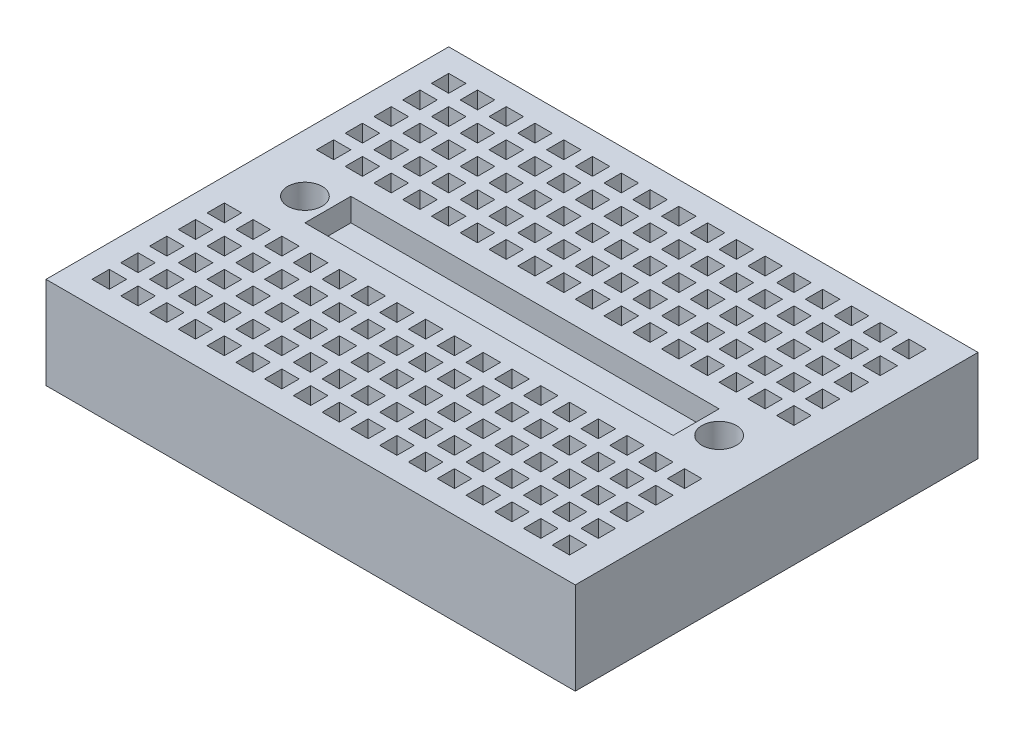
from build123d import *

# Parameters (mm, degrees)
SKETCH1_W           = 46
SKETCH1_H           = 35
SKETCH1_R           = 1.5
BOSS_EXTRUDE1_DEPTH = 8
SKETCH3_W           = 1.5
SKETCH3_H           = 1.5
CUT_EXTRUDE2_DEPTH  = 7
SKETCH2_W           = 32
SKETCH2_H           = 4
CUT_EXTRUDE1_DEPTH  = 2


with BuildPart() as part:
    # Sketch1 → Boss-Extrude1 (new body)
    with BuildSketch(Plane(origin=(0, 0, 0), x_dir=(1, 0, 0), z_dir=(0, 1, 0))):
        Rectangle(SKETCH1_W, SKETCH1_H)
        with Locations((18, 0)):
            Circle(SKETCH1_R, mode=Mode.SUBTRACT)
        with Locations((-18, 0)):
            Circle(SKETCH1_R, mode=Mode.SUBTRACT)
    extrude(amount=BOSS_EXTRUDE1_DEPTH)

    # Sketch3 → Cut-Extrude2 (cut)
    with BuildSketch(Plane(origin=(0, 8, 0), x_dir=(1, 0, 0), z_dir=(0, 1, 0))):
        with Locations((-20.25, 14.75)):
            Rectangle(SKETCH3_W, SKETCH3_H)
        with Locations((-17.75, 14.75)):
            Rectangle(SKETCH3_W, SKETCH3_H)
        with Locations((-15.25, 14.75)):
            Rectangle(SKETCH3_W, SKETCH3_H)
        with Locations((-12.75, 14.75)):
            Rectangle(SKETCH3_W, SKETCH3_H)
        with Locations((-10.25, 14.75)):
            Rectangle(SKETCH3_W, SKETCH3_H)
        with Locations((-7.75, 14.75)):
            Rectangle(SKETCH3_W, SKETCH3_H)
        with Locations((-5.25, 14.75)):
            Rectangle(SKETCH3_W, SKETCH3_H)
        with Locations((-2.75, 14.75)):
            Rectangle(SKETCH3_W, SKETCH3_H)
        with Locations((-0.25, 14.75)):
            Rectangle(SKETCH3_W, SKETCH3_H)
        with Locations((2.25, 14.75)):
            Rectangle(SKETCH3_W, SKETCH3_H)
        with Locations((4.75, 14.75)):
            Rectangle(SKETCH3_W, SKETCH3_H)
        with Locations((7.25, 14.75)):
            Rectangle(SKETCH3_W, SKETCH3_H)
        with Locations((9.75, 14.75)):
            Rectangle(SKETCH3_W, SKETCH3_H)
        with Locations((12.25, 14.75)):
            Rectangle(SKETCH3_W, SKETCH3_H)
        with Locations((14.75, 14.75)):
            Rectangle(SKETCH3_W, SKETCH3_H)
        with Locations((17.25, 14.75)):
            Rectangle(SKETCH3_W, SKETCH3_H)
        with Locations((19.75, 14.75)):
            Rectangle(SKETCH3_W, SKETCH3_H)
        with Locations((-17.75, 12.25)):
            Rectangle(SKETCH3_W, SKETCH3_H)
        with Locations((-15.25, 12.25)):
            Rectangle(SKETCH3_W, SKETCH3_H)
        with Locations((-12.75, 12.25)):
            Rectangle(SKETCH3_W, SKETCH3_H)
        with Locations((-10.25, 12.25)):
            Rectangle(SKETCH3_W, SKETCH3_H)
        with Locations((-7.75, 12.25)):
            Rectangle(SKETCH3_W, SKETCH3_H)
        with Locations((-5.25, 12.25)):
            Rectangle(SKETCH3_W, SKETCH3_H)
        with Locations((-2.75, 12.25)):
            Rectangle(SKETCH3_W, SKETCH3_H)
        with Locations((-0.25, 12.25)):
            Rectangle(SKETCH3_W, SKETCH3_H)
        with Locations((2.25, 12.25)):
            Rectangle(SKETCH3_W, SKETCH3_H)
        with Locations((4.75, 12.25)):
            Rectangle(SKETCH3_W, SKETCH3_H)
        with Locations((7.25, 12.25)):
            Rectangle(SKETCH3_W, SKETCH3_H)
        with Locations((9.75, 12.25)):
            Rectangle(SKETCH3_W, SKETCH3_H)
        with Locations((12.25, 12.25)):
            Rectangle(SKETCH3_W, SKETCH3_H)
        with Locations((14.75, 12.25)):
            Rectangle(SKETCH3_W, SKETCH3_H)
        with Locations((17.25, 12.25)):
            Rectangle(SKETCH3_W, SKETCH3_H)
        with Locations((19.75, 12.25)):
            Rectangle(SKETCH3_W, SKETCH3_H)
        with Locations((-17.75, 9.75)):
            Rectangle(SKETCH3_W, SKETCH3_H)
        with Locations((-15.25, 9.75)):
            Rectangle(SKETCH3_W, SKETCH3_H)
        with Locations((-12.75, 9.75)):
            Rectangle(SKETCH3_W, SKETCH3_H)
        with Locations((-10.25, 9.75)):
            Rectangle(SKETCH3_W, SKETCH3_H)
        with Locations((-7.75, 9.75)):
            Rectangle(SKETCH3_W, SKETCH3_H)
        with Locations((-5.25, 9.75)):
            Rectangle(SKETCH3_W, SKETCH3_H)
        with Locations((-2.75, 9.75)):
            Rectangle(SKETCH3_W, SKETCH3_H)
        with Locations((-0.25, 9.75)):
            Rectangle(SKETCH3_W, SKETCH3_H)
        with Locations((2.25, 9.75)):
            Rectangle(SKETCH3_W, SKETCH3_H)
        with Locations((4.75, 9.75)):
            Rectangle(SKETCH3_W, SKETCH3_H)
        with Locations((7.25, 9.75)):
            Rectangle(SKETCH3_W, SKETCH3_H)
        with Locations((9.75, 9.75)):
            Rectangle(SKETCH3_W, SKETCH3_H)
        with Locations((12.25, 9.75)):
            Rectangle(SKETCH3_W, SKETCH3_H)
        with Locations((14.75, 9.75)):
            Rectangle(SKETCH3_W, SKETCH3_H)
        with Locations((17.25, 9.75)):
            Rectangle(SKETCH3_W, SKETCH3_H)
        with Locations((19.75, 9.75)):
            Rectangle(SKETCH3_W, SKETCH3_H)
        with Locations((-17.75, 7.25)):
            Rectangle(SKETCH3_W, SKETCH3_H)
        with Locations((-15.25, 7.25)):
            Rectangle(SKETCH3_W, SKETCH3_H)
        with Locations((-12.75, 7.25)):
            Rectangle(SKETCH3_W, SKETCH3_H)
        with Locations((-10.25, 7.25)):
            Rectangle(SKETCH3_W, SKETCH3_H)
        with Locations((-7.75, 7.25)):
            Rectangle(SKETCH3_W, SKETCH3_H)
        with Locations((-5.25, 7.25)):
            Rectangle(SKETCH3_W, SKETCH3_H)
        with Locations((-2.75, 7.25)):
            Rectangle(SKETCH3_W, SKETCH3_H)
        with Locations((-0.25, 7.25)):
            Rectangle(SKETCH3_W, SKETCH3_H)
        with Locations((2.25, 7.25)):
            Rectangle(SKETCH3_W, SKETCH3_H)
        with Locations((4.75, 7.25)):
            Rectangle(SKETCH3_W, SKETCH3_H)
        with Locations((7.25, 7.25)):
            Rectangle(SKETCH3_W, SKETCH3_H)
        with Locations((9.75, 7.25)):
            Rectangle(SKETCH3_W, SKETCH3_H)
        with Locations((12.25, 7.25)):
            Rectangle(SKETCH3_W, SKETCH3_H)
        with Locations((14.75, 7.25)):
            Rectangle(SKETCH3_W, SKETCH3_H)
        with Locations((17.25, 7.25)):
            Rectangle(SKETCH3_W, SKETCH3_H)
        with Locations((19.75, 7.25)):
            Rectangle(SKETCH3_W, SKETCH3_H)
        with Locations((-17.75, 4.75)):
            Rectangle(SKETCH3_W, SKETCH3_H)
        with Locations((-15.25, 4.75)):
            Rectangle(SKETCH3_W, SKETCH3_H)
        with Locations((-12.75, 4.75)):
            Rectangle(SKETCH3_W, SKETCH3_H)
        with Locations((-10.25, 4.75)):
            Rectangle(SKETCH3_W, SKETCH3_H)
        with Locations((-7.75, 4.75)):
            Rectangle(SKETCH3_W, SKETCH3_H)
        with Locations((-5.25, 4.75)):
            Rectangle(SKETCH3_W, SKETCH3_H)
        with Locations((-2.75, 4.75)):
            Rectangle(SKETCH3_W, SKETCH3_H)
        with Locations((-0.25, 4.75)):
            Rectangle(SKETCH3_W, SKETCH3_H)
        with Locations((2.25, 4.75)):
            Rectangle(SKETCH3_W, SKETCH3_H)
        with Locations((4.75, 4.75)):
            Rectangle(SKETCH3_W, SKETCH3_H)
        with Locations((7.25, 4.75)):
            Rectangle(SKETCH3_W, SKETCH3_H)
        with Locations((9.75, 4.75)):
            Rectangle(SKETCH3_W, SKETCH3_H)
        with Locations((12.25, 4.75)):
            Rectangle(SKETCH3_W, SKETCH3_H)
        with Locations((14.75, 4.75)):
            Rectangle(SKETCH3_W, SKETCH3_H)
        with Locations((17.25, 4.75)):
            Rectangle(SKETCH3_W, SKETCH3_H)
        with Locations((19.75, 4.75)):
            Rectangle(SKETCH3_W, SKETCH3_H)
        with Locations((-20.25, 12.25)):
            Rectangle(SKETCH3_W, SKETCH3_H)
        with Locations((-20.25, 9.75)):
            Rectangle(SKETCH3_W, SKETCH3_H)
        with Locations((-20.25, 7.25)):
            Rectangle(SKETCH3_W, SKETCH3_H)
        with Locations((-20.25, 4.75)):
            Rectangle(SKETCH3_W, SKETCH3_H)
        with Locations((-20.25, -4.75)):
            Rectangle(SKETCH3_W, SKETCH3_H)
        with Locations((-20.25, -7.25)):
            Rectangle(SKETCH3_W, SKETCH3_H)
        with Locations((-20.25, -9.75)):
            Rectangle(SKETCH3_W, SKETCH3_H)
        with Locations((-20.25, -12.25)):
            Rectangle(SKETCH3_W, SKETCH3_H)
        with Locations((19.75, -4.75)):
            Rectangle(SKETCH3_W, SKETCH3_H)
        with Locations((17.25, -4.75)):
            Rectangle(SKETCH3_W, SKETCH3_H)
        with Locations((14.75, -4.75)):
            Rectangle(SKETCH3_W, SKETCH3_H)
        with Locations((12.25, -4.75)):
            Rectangle(SKETCH3_W, SKETCH3_H)
        with Locations((9.75, -4.75)):
            Rectangle(SKETCH3_W, SKETCH3_H)
        with Locations((7.25, -4.75)):
            Rectangle(SKETCH3_W, SKETCH3_H)
        with Locations((4.75, -4.75)):
            Rectangle(SKETCH3_W, SKETCH3_H)
        with Locations((2.25, -4.75)):
            Rectangle(SKETCH3_W, SKETCH3_H)
        with Locations((-0.25, -4.75)):
            Rectangle(SKETCH3_W, SKETCH3_H)
        with Locations((-2.75, -4.75)):
            Rectangle(SKETCH3_W, SKETCH3_H)
        with Locations((-5.25, -4.75)):
            Rectangle(SKETCH3_W, SKETCH3_H)
        with Locations((-7.75, -4.75)):
            Rectangle(SKETCH3_W, SKETCH3_H)
        with Locations((-10.25, -4.75)):
            Rectangle(SKETCH3_W, SKETCH3_H)
        with Locations((-12.75, -4.75)):
            Rectangle(SKETCH3_W, SKETCH3_H)
        with Locations((-15.25, -4.75)):
            Rectangle(SKETCH3_W, SKETCH3_H)
        with Locations((-17.75, -4.75)):
            Rectangle(SKETCH3_W, SKETCH3_H)
        with Locations((19.75, -7.25)):
            Rectangle(SKETCH3_W, SKETCH3_H)
        with Locations((17.25, -7.25)):
            Rectangle(SKETCH3_W, SKETCH3_H)
        with Locations((14.75, -7.25)):
            Rectangle(SKETCH3_W, SKETCH3_H)
        with Locations((12.25, -7.25)):
            Rectangle(SKETCH3_W, SKETCH3_H)
        with Locations((9.75, -7.25)):
            Rectangle(SKETCH3_W, SKETCH3_H)
        with Locations((7.25, -7.25)):
            Rectangle(SKETCH3_W, SKETCH3_H)
        with Locations((4.75, -7.25)):
            Rectangle(SKETCH3_W, SKETCH3_H)
        with Locations((2.25, -7.25)):
            Rectangle(SKETCH3_W, SKETCH3_H)
        with Locations((-0.25, -7.25)):
            Rectangle(SKETCH3_W, SKETCH3_H)
        with Locations((-2.75, -7.25)):
            Rectangle(SKETCH3_W, SKETCH3_H)
        with Locations((-5.25, -7.25)):
            Rectangle(SKETCH3_W, SKETCH3_H)
        with Locations((-7.75, -7.25)):
            Rectangle(SKETCH3_W, SKETCH3_H)
        with Locations((-10.25, -7.25)):
            Rectangle(SKETCH3_W, SKETCH3_H)
        with Locations((-12.75, -7.25)):
            Rectangle(SKETCH3_W, SKETCH3_H)
        with Locations((-15.25, -7.25)):
            Rectangle(SKETCH3_W, SKETCH3_H)
        with Locations((-17.75, -7.25)):
            Rectangle(SKETCH3_W, SKETCH3_H)
        with Locations((19.75, -9.75)):
            Rectangle(SKETCH3_W, SKETCH3_H)
        with Locations((17.25, -9.75)):
            Rectangle(SKETCH3_W, SKETCH3_H)
        with Locations((14.75, -9.75)):
            Rectangle(SKETCH3_W, SKETCH3_H)
        with Locations((12.25, -9.75)):
            Rectangle(SKETCH3_W, SKETCH3_H)
        with Locations((9.75, -9.75)):
            Rectangle(SKETCH3_W, SKETCH3_H)
        with Locations((7.25, -9.75)):
            Rectangle(SKETCH3_W, SKETCH3_H)
        with Locations((4.75, -9.75)):
            Rectangle(SKETCH3_W, SKETCH3_H)
        with Locations((2.25, -9.75)):
            Rectangle(SKETCH3_W, SKETCH3_H)
        with Locations((-0.25, -9.75)):
            Rectangle(SKETCH3_W, SKETCH3_H)
        with Locations((-2.75, -9.75)):
            Rectangle(SKETCH3_W, SKETCH3_H)
        with Locations((-5.25, -9.75)):
            Rectangle(SKETCH3_W, SKETCH3_H)
        with Locations((-7.75, -9.75)):
            Rectangle(SKETCH3_W, SKETCH3_H)
        with Locations((-10.25, -9.75)):
            Rectangle(SKETCH3_W, SKETCH3_H)
        with Locations((-12.75, -9.75)):
            Rectangle(SKETCH3_W, SKETCH3_H)
        with Locations((-15.25, -9.75)):
            Rectangle(SKETCH3_W, SKETCH3_H)
        with Locations((-17.75, -9.75)):
            Rectangle(SKETCH3_W, SKETCH3_H)
        with Locations((19.75, -12.25)):
            Rectangle(SKETCH3_W, SKETCH3_H)
        with Locations((17.25, -12.25)):
            Rectangle(SKETCH3_W, SKETCH3_H)
        with Locations((14.75, -12.25)):
            Rectangle(SKETCH3_W, SKETCH3_H)
        with Locations((12.25, -12.25)):
            Rectangle(SKETCH3_W, SKETCH3_H)
        with Locations((9.75, -12.25)):
            Rectangle(SKETCH3_W, SKETCH3_H)
        with Locations((7.25, -12.25)):
            Rectangle(SKETCH3_W, SKETCH3_H)
        with Locations((4.75, -12.25)):
            Rectangle(SKETCH3_W, SKETCH3_H)
        with Locations((2.25, -12.25)):
            Rectangle(SKETCH3_W, SKETCH3_H)
        with Locations((-0.25, -12.25)):
            Rectangle(SKETCH3_W, SKETCH3_H)
        with Locations((-2.75, -12.25)):
            Rectangle(SKETCH3_W, SKETCH3_H)
        with Locations((-5.25, -12.25)):
            Rectangle(SKETCH3_W, SKETCH3_H)
        with Locations((-7.75, -12.25)):
            Rectangle(SKETCH3_W, SKETCH3_H)
        with Locations((-10.25, -12.25)):
            Rectangle(SKETCH3_W, SKETCH3_H)
        with Locations((-12.75, -12.25)):
            Rectangle(SKETCH3_W, SKETCH3_H)
        with Locations((-15.25, -12.25)):
            Rectangle(SKETCH3_W, SKETCH3_H)
        with Locations((-17.75, -12.25)):
            Rectangle(SKETCH3_W, SKETCH3_H)
        with Locations((19.75, -14.75)):
            Rectangle(SKETCH3_W, SKETCH3_H)
        with Locations((17.25, -14.75)):
            Rectangle(SKETCH3_W, SKETCH3_H)
        with Locations((14.75, -14.75)):
            Rectangle(SKETCH3_W, SKETCH3_H)
        with Locations((12.25, -14.75)):
            Rectangle(SKETCH3_W, SKETCH3_H)
        with Locations((9.75, -14.75)):
            Rectangle(SKETCH3_W, SKETCH3_H)
        with Locations((7.25, -14.75)):
            Rectangle(SKETCH3_W, SKETCH3_H)
        with Locations((4.75, -14.75)):
            Rectangle(SKETCH3_W, SKETCH3_H)
        with Locations((2.25, -14.75)):
            Rectangle(SKETCH3_W, SKETCH3_H)
        with Locations((-0.25, -14.75)):
            Rectangle(SKETCH3_W, SKETCH3_H)
        with Locations((-2.75, -14.75)):
            Rectangle(SKETCH3_W, SKETCH3_H)
        with Locations((-5.25, -14.75)):
            Rectangle(SKETCH3_W, SKETCH3_H)
        with Locations((-7.75, -14.75)):
            Rectangle(SKETCH3_W, SKETCH3_H)
        with Locations((-10.25, -14.75)):
            Rectangle(SKETCH3_W, SKETCH3_H)
        with Locations((-12.75, -14.75)):
            Rectangle(SKETCH3_W, SKETCH3_H)
        with Locations((-15.25, -14.75)):
            Rectangle(SKETCH3_W, SKETCH3_H)
        with Locations((-17.75, -14.75)):
            Rectangle(SKETCH3_W, SKETCH3_H)
        with Locations((-20.25, -14.75)):
            Rectangle(SKETCH3_W, SKETCH3_H)
    extrude(amount=-CUT_EXTRUDE2_DEPTH, mode=Mode.SUBTRACT)

    # Sketch2 → Cut-Extrude1 (cut)
    with BuildSketch(Plane(origin=(0, 8, 0), x_dir=(1, 0, 0), z_dir=(0, 1, 0))):
        Rectangle(SKETCH2_W, SKETCH2_H)
    extrude(amount=-CUT_EXTRUDE1_DEPTH, mode=Mode.SUBTRACT)


solid = part.part
